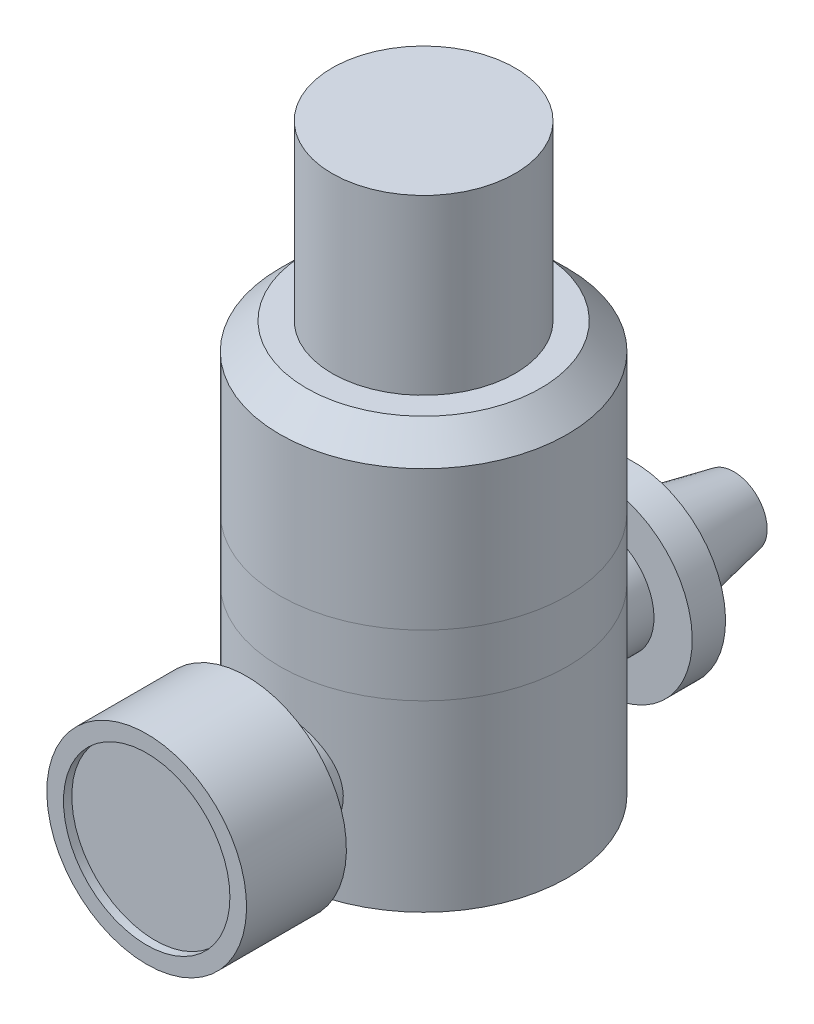
from build123d import *

# Parameters (mm, degrees)
SKETCH1_R           = 13.716
BOSS_EXTRUDE1_DEPTH = 39.1795
CHAMFER1_SIZE       = 2.54
SKETCH3_R           = 8.73125
BOSS_EXTRUDE3_DEPTH = 16.51
SKETCH5_R           = 7.9375
CUT_EXTRUDE1_DEPTH  = 0.79375


# Read off the part's stored shape, not the designer's step: Split3
with BuildPart() as part:
    # Sketch1 → Boss-Extrude1 (new body)
    with BuildSketch(Plane(origin=(0, 0, 0), x_dir=(1, 0, 0), z_dir=(0, 1, 0))):
        with Locations(Location((0, 0, 0), (0, 0, 270))):
            Circle(SKETCH1_R)
    extrude(amount=BOSS_EXTRUDE1_DEPTH)


with BuildPart() as body_2:
    # Split1: the piece on the far side of the plane
    add(part.part)
    split(bisect_by=Plane(origin=(0, 17.4625, 0), x_dir=(0, 0, -1), z_dir=(0, -1, 0)), keep=Keep.BOTTOM)

    # Chamfer1
    chamfer1_edges = [body_2.edges().sort_by_distance(p)[0] for p in [
        (0, 39.1795, -13.716),
    ]]
    chamfer(chamfer1_edges, length=CHAMFER1_SIZE)


with BuildPart() as part_1:
    add(part.part)

    # Split1
    split(bisect_by=Plane(origin=(0, 17.4625, 0), x_dir=(0, 0, -1), z_dir=(0, -1, 0)), keep=Keep.TOP)

    # Sketch4 → Revolve1 (revolve)
    with BuildSketch(Plane(origin=(0, 0, 0), x_dir=(0, 0, -1), z_dir=(1, 0, 0)), mode=Mode.PRIVATE) as revolve1_sk:
        Polygon((-6.858, 8.73125), (-6.858, 13.81125), (-16.891, 13.81125), (-16.891, 18.25625), (-26.416, 18.25625), (-26.416, 8.73125), align=None)
        Polygon((6.858, 8.73125), (6.858, 13.81125), (16.891, 13.81125), (16.891, 17.4625), (20.066, 17.4625), (20.066, 13.81125), (29.591, 11.90625), (29.591, 8.73125), align=None)
    revolve(revolve1_sk.sketch.rotate(Axis((0, 8.73125, 26.416), (0, 0, -1)), 180), axis=Axis((0, 8.73125, 26.416), (0, 0, -1)))

    # Sketch5 → Cut-Extrude1 (cut)
    with BuildSketch(Plane.XY.offset(26.416)):
        with Locations((0, 8.73125)):
            Circle(SKETCH5_R)
    extrude(amount=-CUT_EXTRUDE1_DEPTH, mode=Mode.SUBTRACT)


with BuildPart() as body_3:
    # Sketch3 → Boss-Extrude3 (new body)
    with BuildSketch(Plane(origin=(0, 39.1795, 0), x_dir=(1, 0, 0), z_dir=(0, 1, 0))):
        with Locations(Location((0, 0, 0), (0, 0, 270))):
            Circle(SKETCH3_R)
    extrude(amount=BOSS_EXTRUDE3_DEPTH)


with BuildPart() as body_4:
    # Split3: the piece on the far side of the plane
    add(body_2.part)
    split(bisect_by=Plane(origin=(0, 23.3045, 0), x_dir=(1, 0, 0), z_dir=(0, 1, 0)), keep=Keep.BOTTOM)


with BuildPart() as body_2_1:
    add(body_2.part)

    # Split3
    split(bisect_by=Plane(origin=(0, 23.3045, 0), x_dir=(1, 0, 0), z_dir=(0, 1, 0)), keep=Keep.TOP)


solid = Compound([part_1.part, body_3.part, body_4.part, body_2_1.part])
